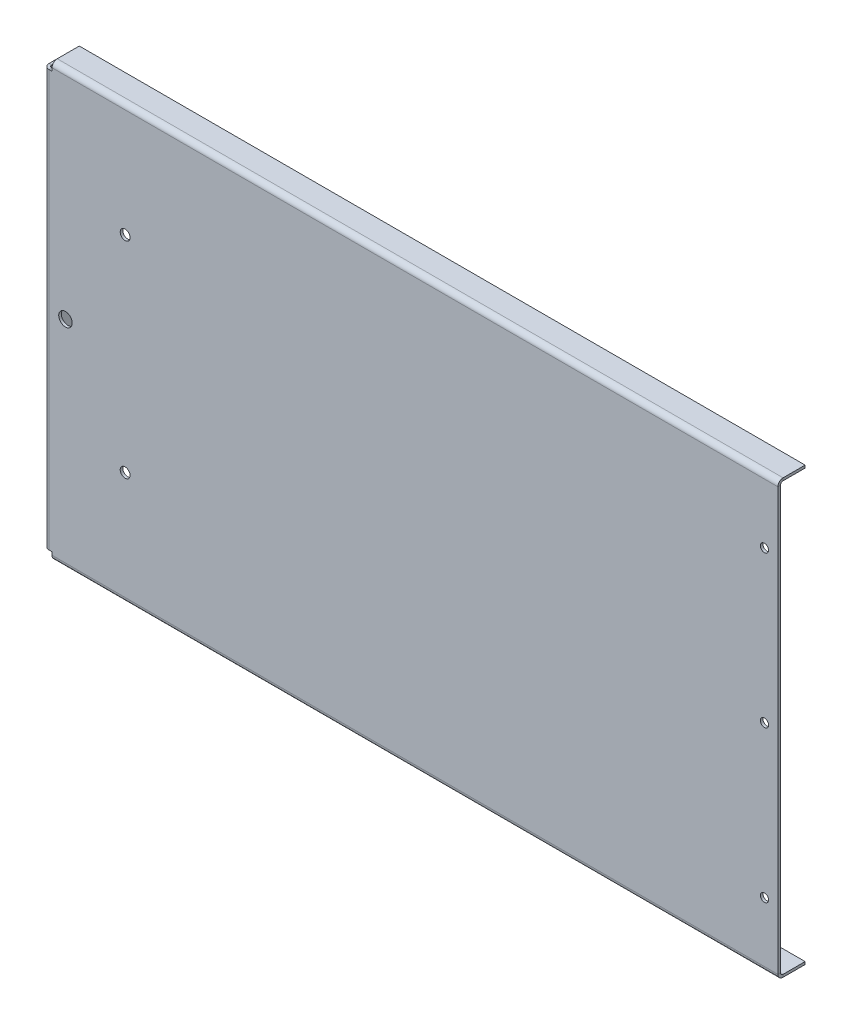
from build123d import *

# Parameters (mm, degrees)
CROQUIS1_W                         = 431.038
CROQUIS1_H                         = 254
BRIDA_BASE1_DEPTH                  = 1.524
CORTAR_EXTRUIR1_REACH              = 252.159
CROQUIS6_W                         = 4.826
CROQUIS6_H                         = 4.826
BRIDA_DE_ARISTA1_STRIP_W           = 9.144
BRIDA_DE_ARISTA1_STRIP_H           = 1.524
BRIDA_DE_ARISTA1_STRIP_CUT_DEPTH   = 426.212
BRIDA_DE_ARISTA1_STRIP_2_W         = 9.144
BRIDA_DE_ARISTA1_STRIP_2_H         = 1.524
BRIDA_DE_ARISTA1_STRIP_CUT_2_DEPTH = 426.212
BRIDA_DE_ARISTA1_STRIP_3_W         = 9.144
BRIDA_DE_ARISTA1_STRIP_3_H         = 1.524
BRIDA_DE_ARISTA1_STRIP_CUT_3_DEPTH = 244.348
BRIDA_DE_ARISTA1_DEPTH             = 426.212
BRIDA_DE_ARISTA1_BEND_DEPTH        = 426.212
BRIDA_DE_ARISTA1_BEND_2_DEPTH      = 244.348
CORTAR_EXTRUIR2_REACH              = 252.666
CROQUIS16_R                        = 3.9624
CROQUIS16_R_2                      = 2.8956
CROQUIS16_R_3                      = 2.413


# Sheet-metal steps are written as plain solids
with BuildPart() as part:
    # Croquis1 → Brida base1 (new body)
    with BuildSketch(Plane.XY):
        Rectangle(CROQUIS1_W, CROQUIS1_H)
    extrude(amount=-BRIDA_BASE1_DEPTH)

    # Croquis6 → Cortar-Extruir1 (cut, up to next)
    with BuildSketch(Plane.XY, mode=Mode.PRIVATE) as cortar_extruir1_sk1:
        with Locations((-213.106, 124.587)):
            Rectangle(CROQUIS6_W, CROQUIS6_H)
    cortar_extruir1_tool1 = extrude(cortar_extruir1_sk1.sketch, amount=-CORTAR_EXTRUIR1_REACH, mode=Mode.PRIVATE) & part.part
    # Croquis6 → Cortar-Extruir1 (cut, up to next)
    with BuildSketch(Plane.XY, mode=Mode.PRIVATE) as cortar_extruir1_sk2:
        with Locations((-213.106, -124.587)):
            Rectangle(CROQUIS6_W, CROQUIS6_H)
    cortar_extruir1_tool2 = extrude(cortar_extruir1_sk2.sketch, amount=-CORTAR_EXTRUIR1_REACH, mode=Mode.PRIVATE) & part.part
    add(cortar_extruir1_tool1.solids().sort_by_distance((-213.106, 124.587, 0))[0], mode=Mode.SUBTRACT)
    add(cortar_extruir1_tool2.solids().sort_by_distance((-213.106, -124.587, 0))[0], mode=Mode.SUBTRACT)

    # Brida de arista1 strip (across the edge) → Brida de arista1 strip cut (cut)
    with BuildSketch(Plane(origin=(-210.693, 127, -1.524), x_dir=(0, -1, 0), z_dir=(1, 0, 0))):
        with Locations((-1.524, -0.762)):
            Rectangle(BRIDA_DE_ARISTA1_STRIP_W, BRIDA_DE_ARISTA1_STRIP_H)
    extrude(amount=BRIDA_DE_ARISTA1_STRIP_CUT_DEPTH, mode=Mode.SUBTRACT)

    # Brida de arista1 strip 2 (across the edge) → Brida de arista1 strip cut 2 (cut)
    with BuildSketch(Plane(origin=(215.519, -127, -1.524), x_dir=(0, 1, 0), z_dir=(-1, 0, 0))):
        with Locations((-1.524, -0.762)):
            Rectangle(BRIDA_DE_ARISTA1_STRIP_2_W, BRIDA_DE_ARISTA1_STRIP_2_H)
    extrude(amount=BRIDA_DE_ARISTA1_STRIP_CUT_2_DEPTH, mode=Mode.SUBTRACT)

    # Brida de arista1 strip 3 (across the edge) → Brida de arista1 strip cut 3 (cut)
    with BuildSketch(Plane(origin=(-215.519, -122.174, -1.524), x_dir=(1, 0, 0), z_dir=(0, 1, 0))):
        with Locations((-1.524, -0.762)):
            Rectangle(BRIDA_DE_ARISTA1_STRIP_3_W, BRIDA_DE_ARISTA1_STRIP_3_H)
    extrude(amount=BRIDA_DE_ARISTA1_STRIP_CUT_3_DEPTH, mode=Mode.SUBTRACT)

    # Brida de arista1 section (across the edge) → Brida de arista1 (add)
    with BuildSketch(Plane(origin=(-210.693, 127, -1.524), x_dir=(0, -1, 0), z_dir=(1, 0, 0))):
        with BuildLine():
            Line((0, 1.524), (0, 14.478))
            Line((0, 14.478), (1.524, 14.478))
            Line((1.524, 14.478), (1.524, 1.524))
            ThreePointArc((1.524, 1.524), (1.970369265, 0.446369265), (3.048, 0))
            Line((3.048, 0), (3.048, -1.524))
            ThreePointArc((3.048, -1.524), (0.892738531, -0.631261469), (0, 1.524))
        make_face()
    extrude(amount=BRIDA_DE_ARISTA1_DEPTH)

    # Brida de arista1 section 2 (across the edge) → Brida de arista1 bend (add)
    with BuildSketch(Plane(origin=(215.519, -127, -1.524), x_dir=(0, 1, 0), z_dir=(-1, 0, 0))):
        with BuildLine():
            Line((0, 1.524), (0, 14.478))
            Line((0, 14.478), (1.524, 14.478))
            Line((1.524, 14.478), (1.524, 1.524))
            ThreePointArc((1.524, 1.524), (1.970369265, 0.446369265), (3.048, 0))
            Line((3.048, 0), (3.048, -1.524))
            ThreePointArc((3.048, -1.524), (0.892738531, -0.631261469), (0, 1.524))
        make_face()
    extrude(amount=BRIDA_DE_ARISTA1_BEND_DEPTH)

    # Brida de arista1 section 3 (across the edge) → Brida de arista1 bend 2 (add)
    with BuildSketch(Plane(origin=(-215.519, -122.174, -1.524), x_dir=(1, 0, 0), z_dir=(0, 1, 0))):
        with BuildLine():
            Line((0, 1.524), (0, 14.478))
            Line((0, 14.478), (1.524, 14.478))
            Line((1.524, 14.478), (1.524, 1.524))
            ThreePointArc((1.524, 1.524), (1.970369265, 0.446369265), (3.048, 0))
            Line((3.048, 0), (3.048, -1.524))
            ThreePointArc((3.048, -1.524), (0.892738531, -0.631261469), (0, 1.524))
        make_face()
    extrude(amount=BRIDA_DE_ARISTA1_BEND_2_DEPTH)

    # Croquis16 → Cortar-Extruir2 (cut, up to next)
    with BuildSketch(Plane.XY, mode=Mode.PRIVATE) as cortar_extruir2_sk1:
        with Locations((-202.819, 0)):
            Circle(CROQUIS16_R)
    cortar_extruir2_tool1 = extrude(cortar_extruir2_sk1.sketch, amount=-CORTAR_EXTRUIR2_REACH, mode=Mode.PRIVATE) & part.part
    # Croquis16 → Cortar-Extruir2 (cut, up to next)
    with BuildSketch(Plane.XY, mode=Mode.PRIVATE) as cortar_extruir2_sk2:
        with Locations((-167.767, 60.452)):
            Circle(CROQUIS16_R_2)
    cortar_extruir2_tool2 = extrude(cortar_extruir2_sk2.sketch, amount=-CORTAR_EXTRUIR2_REACH, mode=Mode.PRIVATE) & part.part
    # Croquis16 → Cortar-Extruir2 (cut, up to next)
    with BuildSketch(Plane.XY, mode=Mode.PRIVATE) as cortar_extruir2_sk3:
        with Locations((-167.767, -60.452)):
            Circle(CROQUIS16_R_2)
    cortar_extruir2_tool3 = extrude(cortar_extruir2_sk3.sketch, amount=-CORTAR_EXTRUIR2_REACH, mode=Mode.PRIVATE) & part.part
    # Croquis16 → Cortar-Extruir2 (cut, up to next)
    with BuildSketch(Plane.XY, mode=Mode.PRIVATE) as cortar_extruir2_sk4:
        with Locations((207.645, 88.9)):
            Circle(CROQUIS16_R_3)
    cortar_extruir2_tool4 = extrude(cortar_extruir2_sk4.sketch, amount=-CORTAR_EXTRUIR2_REACH, mode=Mode.PRIVATE) & part.part
    # Croquis16 → Cortar-Extruir2 (cut, up to next)
    with BuildSketch(Plane.XY, mode=Mode.PRIVATE) as cortar_extruir2_sk5:
        with Locations((207.645, 0)):
            Circle(CROQUIS16_R_3)
    cortar_extruir2_tool5 = extrude(cortar_extruir2_sk5.sketch, amount=-CORTAR_EXTRUIR2_REACH, mode=Mode.PRIVATE) & part.part
    # Croquis16 → Cortar-Extruir2 (cut, up to next)
    with BuildSketch(Plane.XY, mode=Mode.PRIVATE) as cortar_extruir2_sk6:
        with Locations((207.645, -88.9)):
            Circle(CROQUIS16_R_3)
    cortar_extruir2_tool6 = extrude(cortar_extruir2_sk6.sketch, amount=-CORTAR_EXTRUIR2_REACH, mode=Mode.PRIVATE) & part.part
    add(cortar_extruir2_tool1.solids().sort_by_distance((-202.819, 0, 0))[0], mode=Mode.SUBTRACT)
    add(cortar_extruir2_tool2.solids().sort_by_distance((-167.767, 60.452, 0))[0], mode=Mode.SUBTRACT)
    add(cortar_extruir2_tool3.solids().sort_by_distance((-167.767, -60.452, 0))[0], mode=Mode.SUBTRACT)
    add(cortar_extruir2_tool4.solids().sort_by_distance((207.645, 88.9, 0))[0], mode=Mode.SUBTRACT)
    add(cortar_extruir2_tool5.solids().sort_by_distance((207.645, 0, 0))[0], mode=Mode.SUBTRACT)
    add(cortar_extruir2_tool6.solids().sort_by_distance((207.645, -88.9, 0))[0], mode=Mode.SUBTRACT)


solid = part.part
